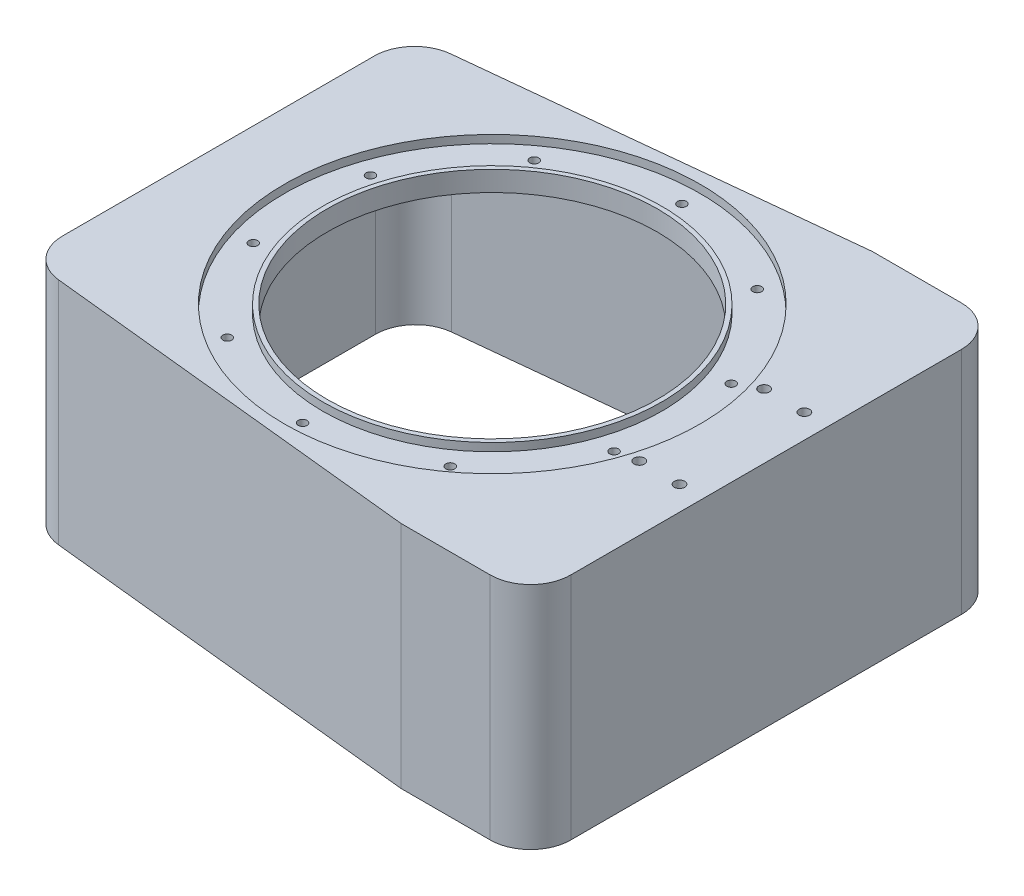
from build123d import *

# Parameters (mm, degrees)
EXTRUDE_1_DEPTH     = 55
EXTRUDE_2_DEPTH     = 2
SKETCH_3_R          = 53
EXTRUDE_3_DEPTH     = 3
SKETCH_4_R          = 51.6
CUT_EXTRUDE_1_DEPTH = 2
SKETCH_5_R          = 41
CUT_EXTRUDE_2_DEPTH = 106.220007603
EXTRUDE_START       = 2
SKETCH_6_R          = 42.1
SKETCH_6_R_2        = 41
EXTRUDE_4_DEPTH     = 2
SKETCH_9_W          = 24
SKETCH_9_H          = 47
EXTRUDE_6_DEPTH     = 9
SKETCH_10_W         = 24
SKETCH_10_H         = 37
CUT_EXTRUDE_6_DEPTH = 6
SKETCH_7_R          = 1.1
CUT_EXTRUDE_3_DEPTH = 106.220007603
FILLET_1_R          = 10
CUT_EXTRUDE_7_REACH = 105.683
SKETCH_11_R         = 1.3
FILLET_2_R          = 4.5


with BuildPart() as part:
    # 스케치1 → 보스-돌출1 (new body)
    with BuildSketch(Plane(origin=(0, 0, 0), x_dir=(1, 0, 0), z_dir=(0, 1, 0))):
        Polygon((-68, -47.70428689), (35.844478487, -58.5), (68, -58.5), (68, 58.5), (35.844478487, 58.5), (-68, 47.70428689), align=None)
        Polygon((-65, -45), (36, -55.5), (65, -55.5), (65, 55.5), (36, 55.5), (-65, 45), align=None, mode=Mode.SUBTRACT)
    extrude(amount=EXTRUDE_1_DEPTH)

    # 스케치2 → 보스-돌출2 (add)
    with BuildSketch(Plane(origin=(0, 55, 0), x_dir=(1, 0, 0), z_dir=(0, 1, 0))):
        Polygon((-68, 47.70428689), (35.844478487, 58.5), (68, 58.5), (68, -58.5), (35.844478487, -58.5), (-68, -47.70428689), align=None)
    extrude(amount=EXTRUDE_2_DEPTH)

    # 스케치3 → 보스-돌출3 (add)
    with BuildSketch(Plane.XZ.offset(-55)):
        Circle(SKETCH_3_R)
    extrude(amount=EXTRUDE_3_DEPTH)

    # 스케치4 → 컷-돌출1 (cut)
    with BuildSketch(Plane(origin=(0, 57, 0), x_dir=(1, 0, 0), z_dir=(0, 1, 0))):
        with Locations(Location((0, 0, 0), (0, 0, 270))):
            Circle(SKETCH_4_R)
    extrude(amount=-CUT_EXTRUDE_1_DEPTH, mode=Mode.SUBTRACT)

    # 스케치5 → 컷-돌출2 (cut, through all)
    with BuildSketch(Plane(origin=(0, 55, 0), x_dir=(1, 0, 0), z_dir=(0, 1, 0))):
        with Locations(Location((0, 0, 0), (0, 0, 270))):
            Circle(SKETCH_5_R)
    extrude(amount=-CUT_EXTRUDE_2_DEPTH, mode=Mode.SUBTRACT)

    # 스케치6 → 보스-돌출4 (add)
    with BuildSketch(Plane(origin=(0, 55, 0), x_dir=(1, 0, 0), z_dir=(0, 1, 0)).offset(EXTRUDE_START)):
        with Locations(Location((0, 0, 0), (0, 0, 270))):
            Circle(SKETCH_6_R)
        with Locations(Location((0, 0, 0), (0, 0, 270))):
            Circle(SKETCH_6_R_2, mode=Mode.SUBTRACT)
    extrude(amount=-EXTRUDE_4_DEPTH)

    # 스케치9 → 보스-돌출6 (add)
    with BuildSketch(Plane.XZ.offset(-55)):
        with Locations((53, 0)):
            Rectangle(SKETCH_9_W, SKETCH_9_H)
    extrude(amount=EXTRUDE_6_DEPTH)

    # 스케치10 → 컷-돌출6 (cut)
    with BuildSketch(Plane.XZ.offset(-46)):
        with Locations((53, 0)):
            Rectangle(SKETCH_10_W, SKETCH_10_H)
    extrude(amount=-CUT_EXTRUDE_6_DEPTH, mode=Mode.SUBTRACT)

    # 스케치7 → 컷-돌출3 (cut, through all)
    with BuildSketch(Plane(origin=(0, 55, 0), x_dir=(1, 0, 0), z_dir=(0, 1, 0))):
        with Locations(Location((0, 47.1, 0), (0, 0, 270))):
            Circle(SKETCH_7_R)
        with Locations(Location((27.684685383, 38.104700435, 0), (0, 0, 270))):
            Circle(SKETCH_7_R)
        with Locations(Location((44.794761918, 14.554700435, 0), (0, 0, 270))):
            Circle(SKETCH_7_R)
        with Locations(Location((44.794761918, -14.554700435, 0), (0, 0, 270))):
            Circle(SKETCH_7_R)
        with Locations(Location((27.684685383, -38.104700435, 0), (0, 0, 270))):
            Circle(SKETCH_7_R)
        with Locations(Location((0, -47.1, 0), (0, 0, 270))):
            Circle(SKETCH_7_R)
        with Locations(Location((-27.684685383, -38.104700435, 0), (0, 0, 270))):
            Circle(SKETCH_7_R)
        with Locations(Location((-44.794761918, -14.554700435, 0), (0, 0, 270))):
            Circle(SKETCH_7_R)
        with Locations(Location((-44.794761918, 14.554700435, 0), (0, 0, 270))):
            Circle(SKETCH_7_R)
        with Locations(Location((-27.684685383, 38.104700435, 0), (0, 0, 270))):
            Circle(SKETCH_7_R)
    extrude(amount=-CUT_EXTRUDE_3_DEPTH, mode=Mode.SUBTRACT)

    # 필렛1
    fillet_1_edges = [part.edges().sort_by_distance(p)[0] for p in [
        (-68, 28.5, -47.70428689),
        (68, 28.5, -58.5),
        (68, 28.5, 58.5),
        (-68, 28.5, 47.70428689),
        (-65, 27.5, -45),
        (-65, 27.5, 45),
        (65, 27.5, 55.5),
        (65, 27.5, -55.5),
    ]]
    fillet(fillet_1_edges, radius=FILLET_1_R)

    # 스케치11 → 컷-돌출7 (cut, up to next)
    with BuildSketch(Plane.XZ.offset(-52), mode=Mode.PRIVATE) as cut_extrude_7_sk1:
        with Locations(Location((52, 15.5, 0), (0, 0, 270))):
            Circle(SKETCH_11_R)
    cut_extrude_7_tool1 = extrude(cut_extrude_7_sk1.sketch, amount=-CUT_EXTRUDE_7_REACH, mode=Mode.PRIVATE) & part.part
    # 스케치11 → 컷-돌출7 (cut, up to next)
    with BuildSketch(Plane.XZ.offset(-52), mode=Mode.PRIVATE) as cut_extrude_7_sk2:
        with Locations(Location((52, -15.5, 0), (0, 0, 270))):
            Circle(SKETCH_11_R)
    cut_extrude_7_tool2 = extrude(cut_extrude_7_sk2.sketch, amount=-CUT_EXTRUDE_7_REACH, mode=Mode.PRIVATE) & part.part
    # 스케치11 → 컷-돌출7 (cut, up to next)
    with BuildSketch(Plane.XZ.offset(-52), mode=Mode.PRIVATE) as cut_extrude_7_sk3:
        with Locations(Location((62, 15.5, 0), (0, 0, 270))):
            Circle(SKETCH_11_R)
    cut_extrude_7_tool3 = extrude(cut_extrude_7_sk3.sketch, amount=-CUT_EXTRUDE_7_REACH, mode=Mode.PRIVATE) & part.part
    # 스케치11 → 컷-돌출7 (cut, up to next)
    with BuildSketch(Plane.XZ.offset(-52), mode=Mode.PRIVATE) as cut_extrude_7_sk4:
        with Locations(Location((62, -15.5, 0), (0, 0, 270))):
            Circle(SKETCH_11_R)
    cut_extrude_7_tool4 = extrude(cut_extrude_7_sk4.sketch, amount=-CUT_EXTRUDE_7_REACH, mode=Mode.PRIVATE) & part.part
    add(cut_extrude_7_tool1.solids().sort_by_distance((52, 52, 15.5))[0], mode=Mode.SUBTRACT)
    add(cut_extrude_7_tool2.solids().sort_by_distance((52, 52, -15.5))[0], mode=Mode.SUBTRACT)
    add(cut_extrude_7_tool3.solids().sort_by_distance((62, 52, 15.5))[0], mode=Mode.SUBTRACT)
    add(cut_extrude_7_tool4.solids().sort_by_distance((62, 52, -15.5))[0], mode=Mode.SUBTRACT)

    # 필렛2
    fillet_2_edges = [part.edges().sort_by_distance(p)[0] for p in [
        (53, 46, 23.5),
        (53, 46, -23.5),
        (56.252631433, 55, -23.5),
        (56.252631433, 55, 23.5),
    ]]
    fillet(fillet_2_edges, radius=FILLET_2_R - 0.0001)  # a hair under: the kernel refuses the full size


solid = part.part
